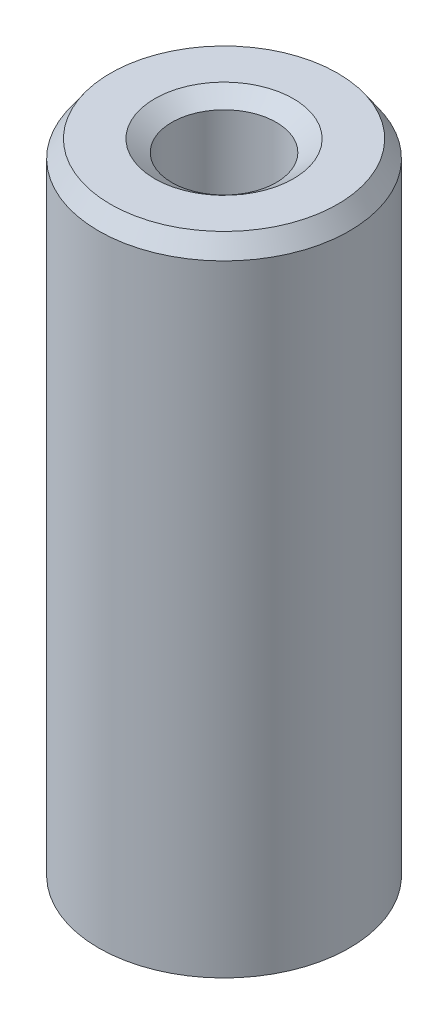
from build123d import *
from OCP.BRepFilletAPI import BRepFilletAPI_MakeChamfer

# Parameters (mm, degrees)
SKETCH1_R           = 7.5
BOSS_EXTRUDE1_DEPTH = 38.857198849
SKETCH2_R           = 3.121792231
CUT_EXTRUDE1_DEPTH  = 41.278802147
CHAMFER1_SIZE       = 1.025618313
CHAMFER1_SIZE2      = 0.709642279


with BuildPart() as part:
    # Sketch1 → Boss-Extrude1 (new body)
    with BuildSketch(Plane(origin=(0, 0, 0), x_dir=(1, 0, 0), z_dir=(0, 1, 0))):
        Circle(SKETCH1_R)
    extrude(amount=BOSS_EXTRUDE1_DEPTH)

    # Sketch2 → Cut-Extrude1 (cut, through all)
    with BuildSketch(Plane(origin=(0, 0, 0), x_dir=(1, 0, 0), z_dir=(0, 1, 0))):
        Circle(SKETCH2_R)
    extrude(amount=CUT_EXTRUDE1_DEPTH, mode=Mode.SUBTRACT)

    # Chamfer1: one chamfer whose edges measure the first distance from different faces: ONE call of the kernel's chamfer builder (chamfer() names one face for all edges)
    chamfer1_edges_1 = [part.edges().sort_by_distance(p)[0] for p in [
        (-3.121792231, 38.857198849, 0),
    ]]
    chamfer1_side_1 = [part.faces().sort_by_distance(p)[0] for p in [
        (-7.287867966, 38.857198849, 0),
    ]]
    chamfer1_edges_2 = [part.edges().sort_by_distance(p)[0] for p in [
        (-3.121792231, 0, 0),
    ]]
    chamfer1_side_2 = [part.faces().sort_by_distance(p)[0] for p in [
        (-3.121792231, 19.428599424, 0),
    ]]
    chamfer1_edges_3 = [part.edges().sort_by_distance(p)[0] for p in [
        (-7.5, 0, 0),
    ]]
    chamfer1_side_3 = [part.faces().sort_by_distance(p)[0] for p in [
        (-7.287867966, 0, 0),
    ]]
    chamfer1_edges_4 = [part.edges().sort_by_distance(p)[0] for p in [
        (-7.5, 38.857198849, 0),
    ]]
    chamfer1_side_4 = [part.faces().sort_by_distance(p)[0] for p in [
        (-7.5, 19.428599424, 0),
    ]]
    chamfer1 = BRepFilletAPI_MakeChamfer(part.part.solid().wrapped)
    for e in chamfer1_edges_1:
        chamfer1.Add(CHAMFER1_SIZE, CHAMFER1_SIZE2, e.wrapped, chamfer1_side_1[0].wrapped)  # the first distance lies on this face
    for e in chamfer1_edges_2:
        chamfer1.Add(CHAMFER1_SIZE, CHAMFER1_SIZE2, e.wrapped, chamfer1_side_2[0].wrapped)  # the first distance lies on this face
    for e in chamfer1_edges_3:
        chamfer1.Add(CHAMFER1_SIZE, CHAMFER1_SIZE2, e.wrapped, chamfer1_side_3[0].wrapped)  # the first distance lies on this face
    for e in chamfer1_edges_4:
        chamfer1.Add(CHAMFER1_SIZE, CHAMFER1_SIZE2, e.wrapped, chamfer1_side_4[0].wrapped)  # the first distance lies on this face
    add(Compound.cast(chamfer1.Shape()), mode=Mode.REPLACE)


solid = part.part
